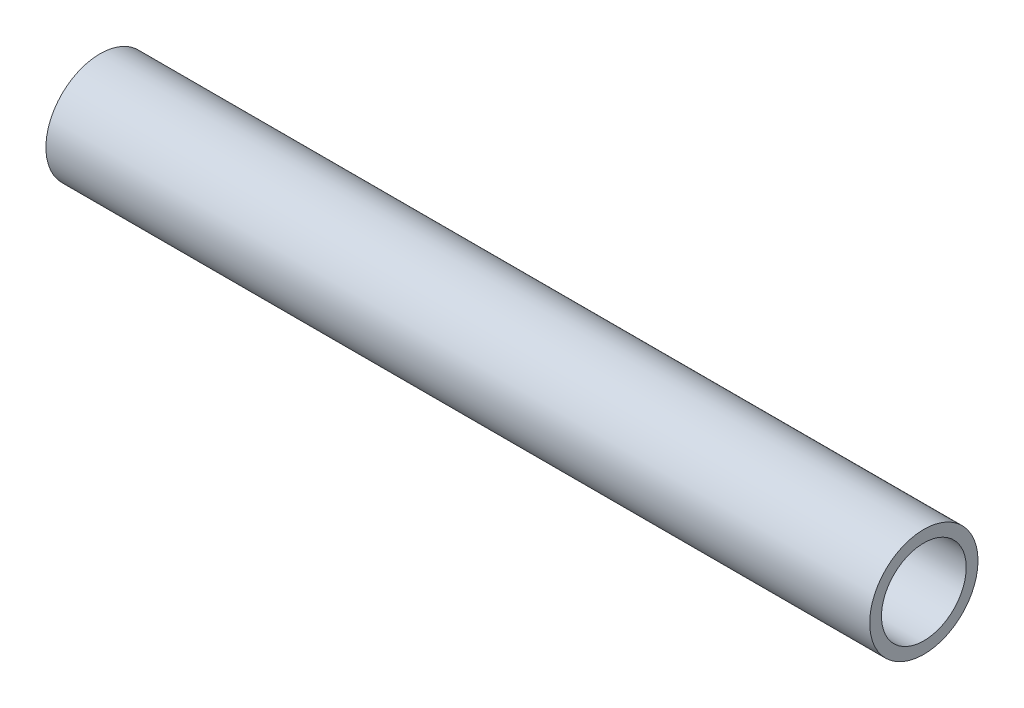
from build123d import *

# Parameters (mm, degrees)
SKETCH1_R           = 16.7005
SKETCH1_R_2         = 13.0683
BOSS_EXTRUDE1_DEPTH = 254


with BuildPart() as part:
    # Sketch1 → Boss-Extrude1 (new body)
    with BuildSketch(Plane(origin=(0, 0, 0), x_dir=(0, 0, -1), z_dir=(1, 0, 0))):
        Circle(SKETCH1_R)
        Circle(SKETCH1_R_2, mode=Mode.SUBTRACT)
    extrude(amount=BOSS_EXTRUDE1_DEPTH)


solid = part.part
